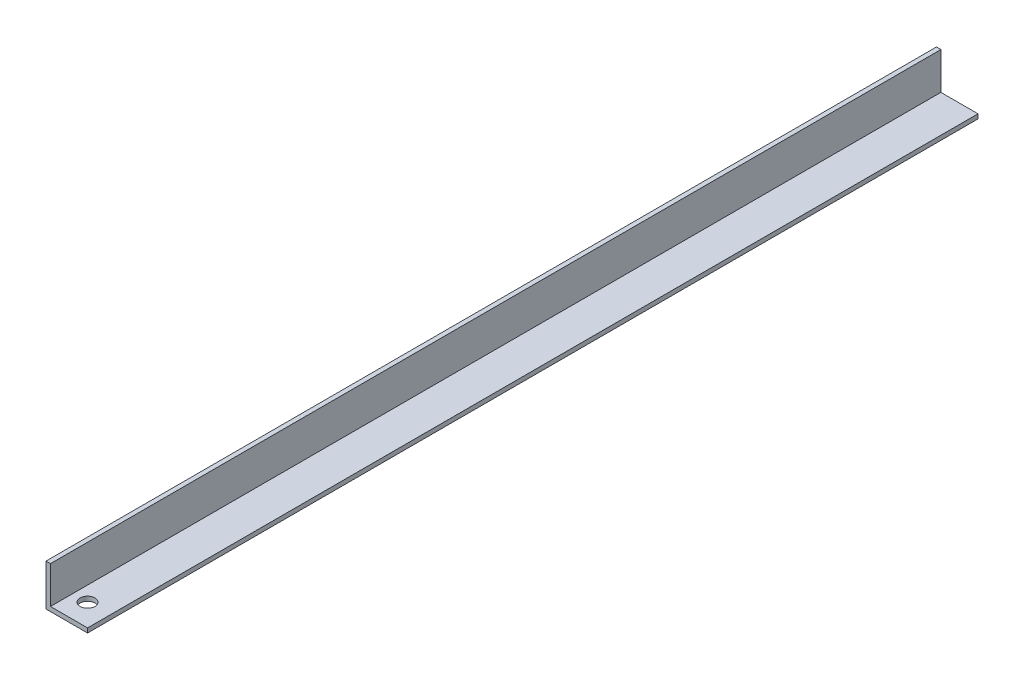
from build123d import *

# Parameters (mm, degrees)
EXTRUDE_1_DEPTH     = 600
SKETCH_2_R          = 5
CUT_EXTRUDE_1_DEPTH = 10


with BuildPart() as part:
    # Эскиз1 → Вытянуть-Тонкостенный1 (new body)
    with BuildSketch(Plane.XY):
        Polygon((0, 25), (0, 0), (25, 0), (25, -3), (-3, -3), (-3, 25), align=None)
    extrude(amount=EXTRUDE_1_DEPTH)

    # Эскиз2 → Вырез-Вытянуть1 (cut)
    with BuildSketch(Plane.XZ.offset(3)):
        with Locations((10, 585)):
            Circle(SKETCH_2_R)
    extrude(amount=-CUT_EXTRUDE_1_DEPTH, mode=Mode.SUBTRACT)


solid = part.part
